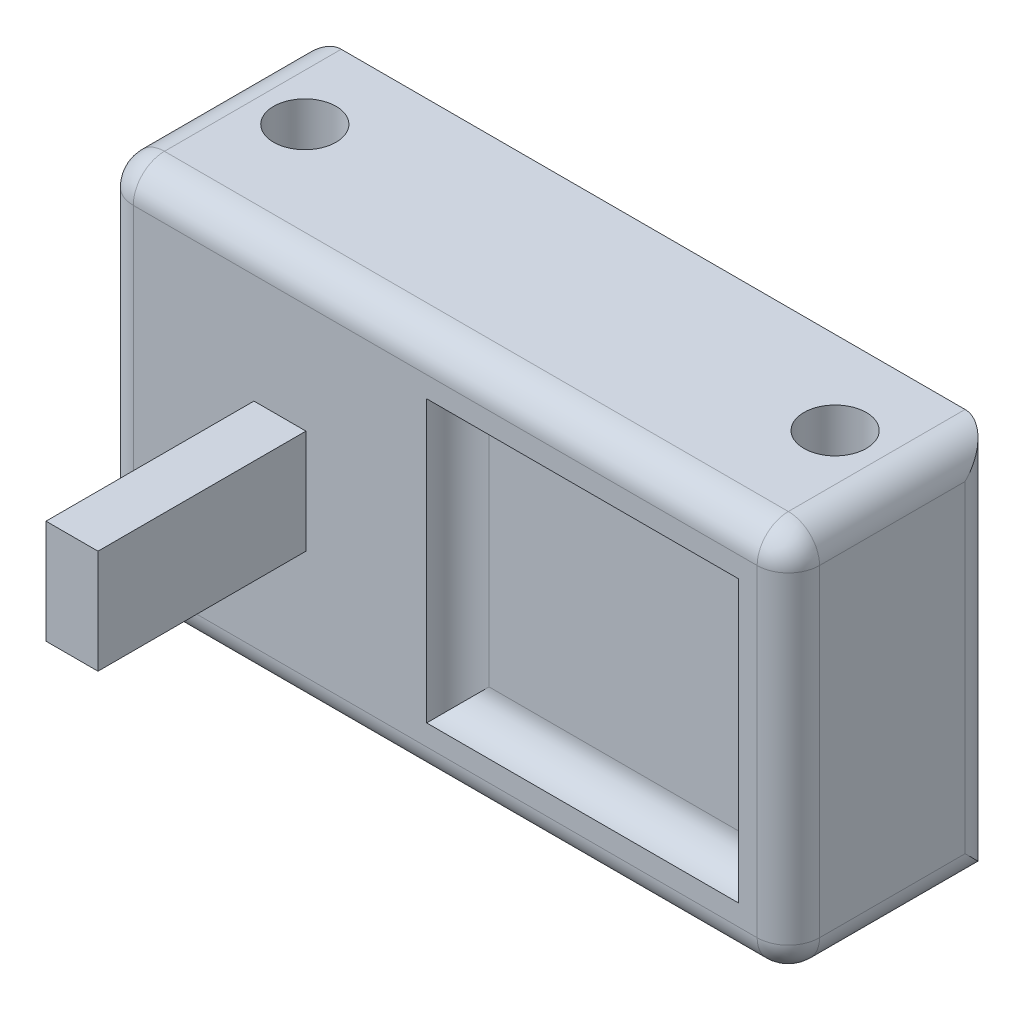
from build123d import *

# Parameters (mm, degrees)
SKIZZE1_W                       = 660
SKIZZE1_H                       = 370
AUFSATZ_LINEAR_AUSTRAGEN1_DEPTH = 200
SKIZZE2_R                       = 30
SCHNITT_LINEAR_AUSTRAGEN1_DEPTH = 566.799856976
VERRUNDUNG1_R                   = 30
SKIZZE3_W                       = 300
SKIZZE3_H                       = 270
SCHNITT_LINEAR_AUSTRAGEN2_DEPTH = 30
VERRUNDUNG2_R                   = 30
SKIZZE5_W                       = 50
SKIZZE5_H                       = 100
AUFSATZ_LINEAR_AUSTRAGEN2_DEPTH = 200


with BuildPart() as part:
    # Skizze1 → Aufsatz-Linear austragen1 (new body)
    with BuildSketch(Plane.XY):
        with Locations((-48.456705786, -9.625748503)):
            Rectangle(SKIZZE1_W, SKIZZE1_H)
    extrude(amount=AUFSATZ_LINEAR_AUSTRAGEN1_DEPTH)

    # Skizze2 → Schnitt-Linear austragen1 (cut, through all)
    with BuildSketch(Plane.XZ.offset(194.625748503)):
        with Locations(Location((-303.456705786, 80, 0), (0, 0, 270))):
            Circle(SKIZZE2_R)
        with Locations(Location((206.543294214, 80, 0), (0, 0, 270))):
            Circle(SKIZZE2_R)
    extrude(amount=-SCHNITT_LINEAR_AUSTRAGEN1_DEPTH, mode=Mode.SUBTRACT)

    # Verrundung1
    verrundung1_edges = [part.edges().sort_by_distance(p)[0] for p in [
        (281.543294214, -9.625748503, 200),
        (-48.456705786, 175.374251497, 200),
        (-378.456705786, -9.625748503, 200),
        (281.543294214, -9.625748503, 0),
        (-378.456705786, -9.625748503, 0),
        (-378.456705786, 175.374251497, 100),
        (281.543294214, 175.374251497, 100),
        (281.543294214, -194.625748503, 100),
        (-378.456705786, -194.625748503, 100),
        (-48.456705786, -194.625748503, 200),
    ]]
    fillet(verrundung1_edges, radius=VERRUNDUNG1_R)

    # Skizze3 → Schnitt-Linear austragen2 (cut)
    with BuildSketch(Plane.XY.offset(200)):
        with Locations((83.717618878, -9.625748503)):
            Rectangle(SKIZZE3_W, SKIZZE3_H)
    extrude(amount=-SCHNITT_LINEAR_AUSTRAGEN2_DEPTH, mode=Mode.SUBTRACT)

    # Verrundung2
    verrundung2_edges = [part.edges().sort_by_distance(p)[0] for p in [
        (233.717618878, -9.625748503, 170),
        (83.717618878, -144.625748503, 170),
        (-66.282381122, -9.625748503, 170),
        (83.717618878, 125.374251497, 170),
    ]]
    fillet(verrundung2_edges, radius=VERRUNDUNG2_R - 0.0001)  # a hair under: the kernel refuses the full size

    # Skizze5 → Aufsatz-Linear austragen2 (add)
    with BuildSketch(Plane.XY.offset(200)):
        with Locations((-207.369543454, -9.625748503)):
            Rectangle(SKIZZE5_W, SKIZZE5_H)
    extrude(amount=AUFSATZ_LINEAR_AUSTRAGEN2_DEPTH)


solid = part.part
